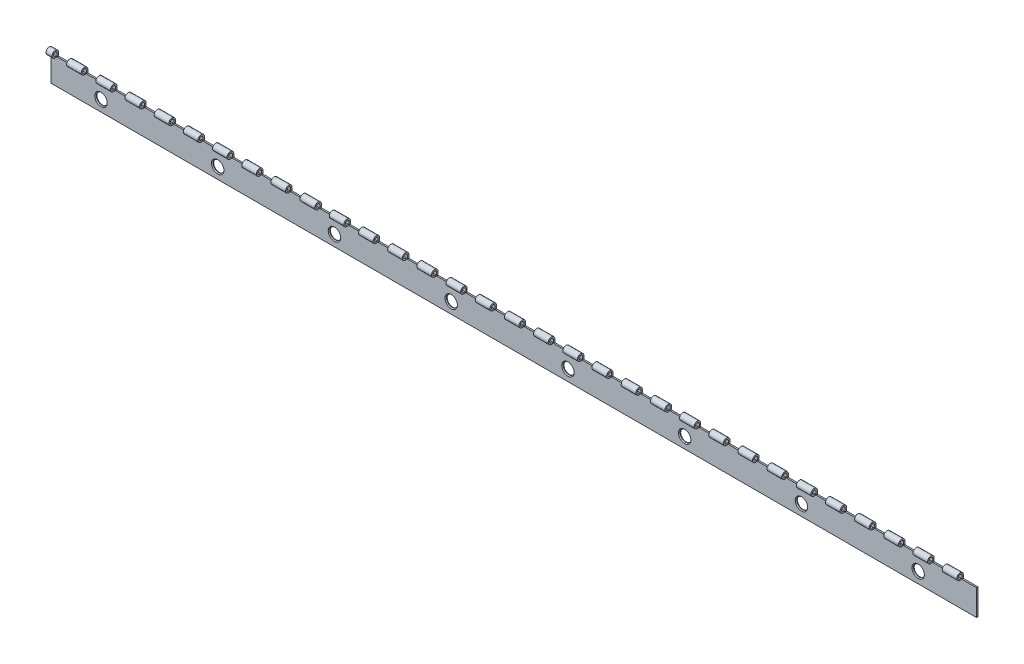
from build123d import *

# Parameters (mm, degrees)
BOSS_EXTRUDE2_DEPTH          = 300.4
SKETCH6_W                    = 6.35
SKETCH6_H                    = 2.8702
CUT_EXTRUDE1_DEPTH           = 301.671763742
LPATTERN1_COUNT              = 47
LPATTERN1_PITCH              = 12.7
CUT_EXTRUDE2_START           = 0.238125
SKETCH8_R                    = 2.3622
CUT_EXTRUDE2_DEPTH           = 0.635
CUT_EXTRUDE2_TAPER           = -41
CUT_EXTRUDE2_OTHER_WAY_DEPTH = 301.68203812
SKETCH13_W                   = 8.788458636
SKETCH13_H                   = 27.110534936
CUT_EXTRUDE4_DEPTH           = 198.12


# Read off the part's stored shape, not the designer's step: LPattern2
with BuildPart() as part:
    # Sketch5 → Boss-Extrude2 (new, symmetric)
    with BuildSketch(Plane(origin=(0, 0, 0), x_dir=(0, 0, -1), z_dir=(1, 0, 0))):
        with BuildLine():
            Line((0.606499467, -1.300642305), (0.338136871, -0.72513686))
            ThreePointArc((0.338136871, -0.72513686), (-0.674797496, 0.429893417), (0.8001, 0))
            Line((0.8001, 0), (0.8001, -12.7))
            Line((0.8001, -12.7), (1.4351, -12.7))
            Line((1.4351, -12.7), (1.4351, 0))
            ThreePointArc((1.4351, 0), (-1.210351064, 0.771078668), (0.606499467, -1.300642305))
        make_face()
    extrude(amount=BOSS_EXTRUDE2_DEPTH, both=True)

    # Sketch6 → Cut-Extrude1 (cut, symmetric)
    with BuildSketch(Plane.XY):
        with Locations((297.225, 0)):
            Rectangle(SKETCH6_W, SKETCH6_H)
    cut_extrude1 = extrude(amount=CUT_EXTRUDE1_DEPTH, both=True, mode=Mode.SUBTRACT)

    # LPattern1: Cut-Extrude1 ×47
    with Locations(*[(-i * LPATTERN1_PITCH, 0, 0) for i in range(1, LPATTERN1_COUNT)]):
        add(cut_extrude1, mode=Mode.SUBTRACT)

    # Sketch8 → Cut-Extrude2 (cut)
    with BuildSketch(Plane.XY.offset(-1.4351).offset(CUT_EXTRUDE2_START)):
        with Locations((275, -7.9375)):
            Circle(SKETCH8_R)
    extrude(amount=CUT_EXTRUDE2_DEPTH, taper=CUT_EXTRUDE2_TAPER, mode=Mode.SUBTRACT)

    # Sketch8 → Cut-Extrude2 other way (cut)
    with BuildSketch(Plane.XY.offset(-1.4351).offset(CUT_EXTRUDE2_START)):
        with Locations((275, -7.9375)):
            Circle(SKETCH8_R)
    extrude(amount=-CUT_EXTRUDE2_OTHER_WAY_DEPTH, mode=Mode.SUBTRACT)

    # LPattern2 outline → LPattern2 (revolve, cut)
    with BuildSketch(Plane(origin=(-283.8, -7.9375, 0), x_dir=(1, 0, 0), z_dir=(0, -1, 0))):
        Polygon((0, -1.4351), (2.3622, -1.4351), (2.3622, -1.196975), (2.707198174, -0.8001), (0, -0.8001), align=None)
    revolve(axis=Axis((-283.8, -7.9375, 0), (0, 0, 1)), mode=Mode.SUBTRACT)

    # LPattern2 2 outline → LPattern2 2 (revolve, cut)
    with BuildSketch(Plane(origin=(-233, -7.9375, 0), x_dir=(1, 0, 0), z_dir=(0, -1, 0))):
        Polygon((0, -1.4351), (2.3622, -1.4351), (2.3622, -1.196975), (2.707198174, -0.8001), (0, -0.8001), align=None)
    revolve(axis=Axis((-233, -7.9375, 0), (0, 0, 1)), mode=Mode.SUBTRACT)

    # LPattern2 3 outline → LPattern2 3 (revolve, cut)
    with BuildSketch(Plane(origin=(-182.2, -7.9375, 0), x_dir=(1, 0, 0), z_dir=(0, -1, 0))):
        Polygon((0, -1.4351), (2.3622, -1.4351), (2.3622, -1.196975), (2.707198174, -0.8001), (0, -0.8001), align=None)
    revolve(axis=Axis((-182.2, -7.9375, 0), (0, 0, 1)), mode=Mode.SUBTRACT)

    # LPattern2 4 outline → LPattern2 4 (revolve, cut)
    with BuildSketch(Plane(origin=(-131.4, -7.9375, 0), x_dir=(1, 0, 0), z_dir=(0, -1, 0))):
        Polygon((0, -1.4351), (2.3622, -1.4351), (2.3622, -1.196975), (2.707198174, -0.8001), (0, -0.8001), align=None)
    revolve(axis=Axis((-131.4, -7.9375, 0), (0, 0, 1)), mode=Mode.SUBTRACT)

    # LPattern2 5 outline → LPattern2 5 (revolve, cut)
    with BuildSketch(Plane(origin=(-80.6, -7.9375, 0), x_dir=(1, 0, 0), z_dir=(0, -1, 0))):
        Polygon((0, -1.4351), (2.3622, -1.4351), (2.3622, -1.196975), (2.707198174, -0.8001), (0, -0.8001), align=None)
    revolve(axis=Axis((-80.6, -7.9375, 0), (0, 0, 1)), mode=Mode.SUBTRACT)

    # LPattern2 6 outline → LPattern2 6 (revolve, cut)
    with BuildSketch(Plane(origin=(-29.8, -7.9375, 0), x_dir=(1, 0, 0), z_dir=(0, -1, 0))):
        Polygon((0, -1.4351), (2.3622, -1.4351), (2.3622, -1.196975), (2.707198174, -0.8001), (0, -0.8001), align=None)
    revolve(axis=Axis((-29.8, -7.9375, 0), (0, 0, 1)), mode=Mode.SUBTRACT)

    # LPattern2 7 outline → LPattern2 7 (revolve, cut)
    with BuildSketch(Plane(origin=(21, -7.9375, 0), x_dir=(1, 0, 0), z_dir=(0, -1, 0))):
        Polygon((0, -1.4351), (2.3622, -1.4351), (2.3622, -1.196975), (2.707198174, -0.8001), (0, -0.8001), align=None)
    revolve(axis=Axis((21, -7.9375, 0), (0, 0, 1)), mode=Mode.SUBTRACT)

    # LPattern2 8 outline → LPattern2 8 (revolve, cut)
    with BuildSketch(Plane(origin=(71.8, -7.9375, 0), x_dir=(1, 0, 0), z_dir=(0, -1, 0))):
        Polygon((0, -1.4351), (2.3622, -1.4351), (2.3622, -1.196975), (2.707198174, -0.8001), (0, -0.8001), align=None)
    revolve(axis=Axis((71.8, -7.9375, 0), (0, 0, 1)), mode=Mode.SUBTRACT)

    # LPattern2 9 outline → LPattern2 9 (revolve, cut)
    with BuildSketch(Plane(origin=(122.6, -7.9375, 0), x_dir=(1, 0, 0), z_dir=(0, -1, 0))):
        Polygon((0, -1.4351), (2.3622, -1.4351), (2.3622, -1.196975), (2.707198174, -0.8001), (0, -0.8001), align=None)
    revolve(axis=Axis((122.6, -7.9375, 0), (0, 0, 1)), mode=Mode.SUBTRACT)

    # LPattern2 10 outline → LPattern2 10 (revolve, cut)
    with BuildSketch(Plane(origin=(173.4, -7.9375, 0), x_dir=(1, 0, 0), z_dir=(0, -1, 0))):
        Polygon((0, -1.4351), (2.3622, -1.4351), (2.3622, -1.196975), (2.707198174, -0.8001), (0, -0.8001), align=None)
    revolve(axis=Axis((173.4, -7.9375, 0), (0, 0, 1)), mode=Mode.SUBTRACT)

    # LPattern2 11 outline → LPattern2 11 (revolve, cut)
    with BuildSketch(Plane(origin=(224.2, -7.9375, 0), x_dir=(1, 0, 0), z_dir=(0, -1, 0))):
        Polygon((2.707198174, -0.8001), (0, -0.8001), (0, -1.4351), (2.3622, -1.4351), (2.3622, -1.196975), align=None)
    revolve(axis=Axis((224.2, -7.9375, 0), (0, 0, 1)), mode=Mode.SUBTRACT)

    # Sketch13 → Cut-Extrude4 (cut)
    with BuildSketch(Plane.ZY.offset(300.4)):
        Rectangle(SKETCH13_W, SKETCH13_H)
    extrude(amount=-CUT_EXTRUDE4_DEPTH, mode=Mode.SUBTRACT)


solid = part.part
